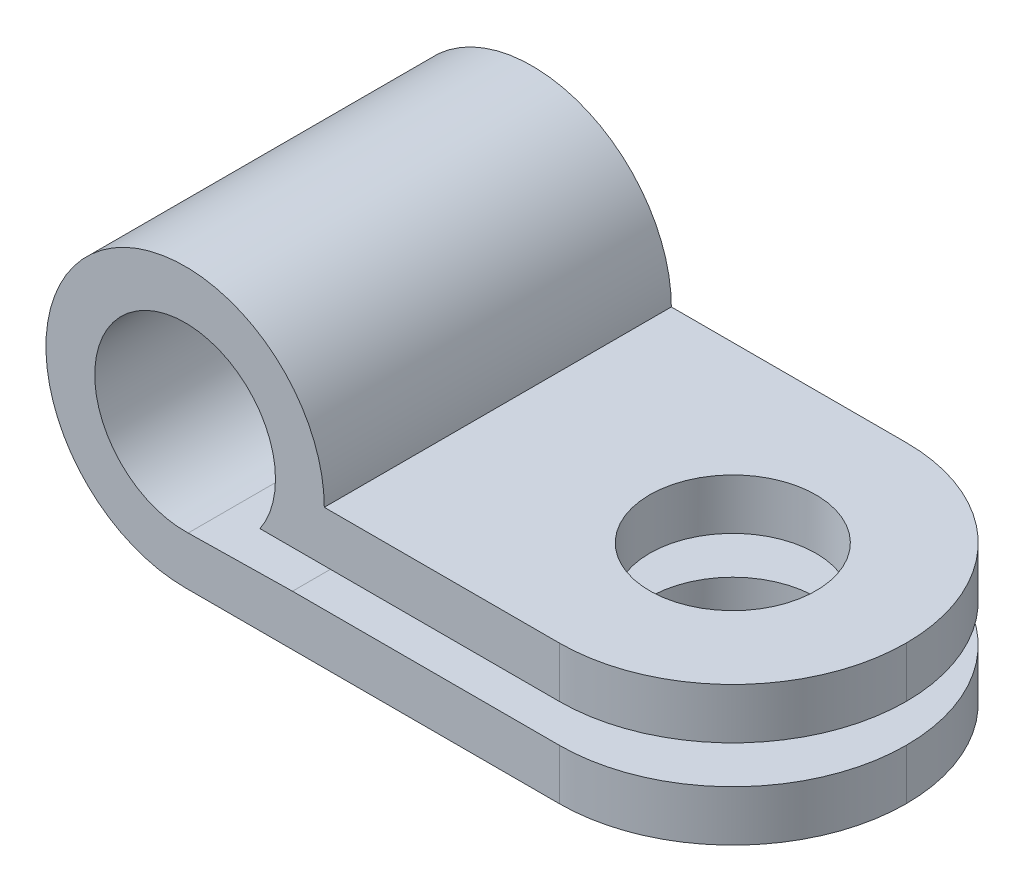
from build123d import *

# Parameters (mm, degrees)
BOSS_EXTRUDE1_DEPTH = 9.6
FILLET1_R           = 4.8
SKETCH2_R           = 2.3
CUT_EXTRUDE1_DEPTH  = 10


with BuildPart() as part:
    # Sketch1 → Boss-Extrude1 (new body)
    with BuildSketch(Plane.XY):
        with BuildLine():
            ThreePointArc((3.85, 0), (-2.722361108, 2.722361108), (0, -3.85))
            Line((0, -3.85), (15.15, -3.85))
            Line((15.15, -3.85), (15.15, -2.45))
            Line((15.15, -2.45), (2.969848481, -2.45))
            Line((2.969848481, -2.45), (0.084155525, -2.498583168))
            ThreePointArc((0.084155525, -2.498583168), (0.042083726, -2.499645767), (0, -2.5))
            ThreePointArc((0, -2.5), (-1.767766953, 1.767766953), (2.5, 0))
            ThreePointArc((2.5, 0), (2.390405697, -0.732093302), (2.071231518, -1.4))
            Line((2.071231518, -1.4), (15.15, -1.4))
            Line((15.15, -1.4), (15.15, 0))
            Line((15.15, 0), (3.85, 0))
        make_face()
    extrude(amount=BOSS_EXTRUDE1_DEPTH)

    # Fillet1
    fillet1_edges = [part.edges().sort_by_distance(p)[0] for p in [
        (15.15, -0.7, 0),
        (15.15, -0.7, 9.6),
        (15.15, -3.15, 0),
        (15.15, -3.15, 9.6),
    ]]
    fillet(fillet1_edges, radius=FILLET1_R - 0.0001)  # a hair under: the kernel refuses the full size

    # Sketch2 → Cut-Extrude1 (cut)
    with BuildSketch(Plane(origin=(0, 0, 0), x_dir=(1, 0, 0), z_dir=(0, 1, 0))):
        with Locations(Location((10.35, -4.8, 0), (0, 0, 180))):
            Circle(SKETCH2_R)
    extrude(amount=-CUT_EXTRUDE1_DEPTH, mode=Mode.SUBTRACT)


solid = part.part
